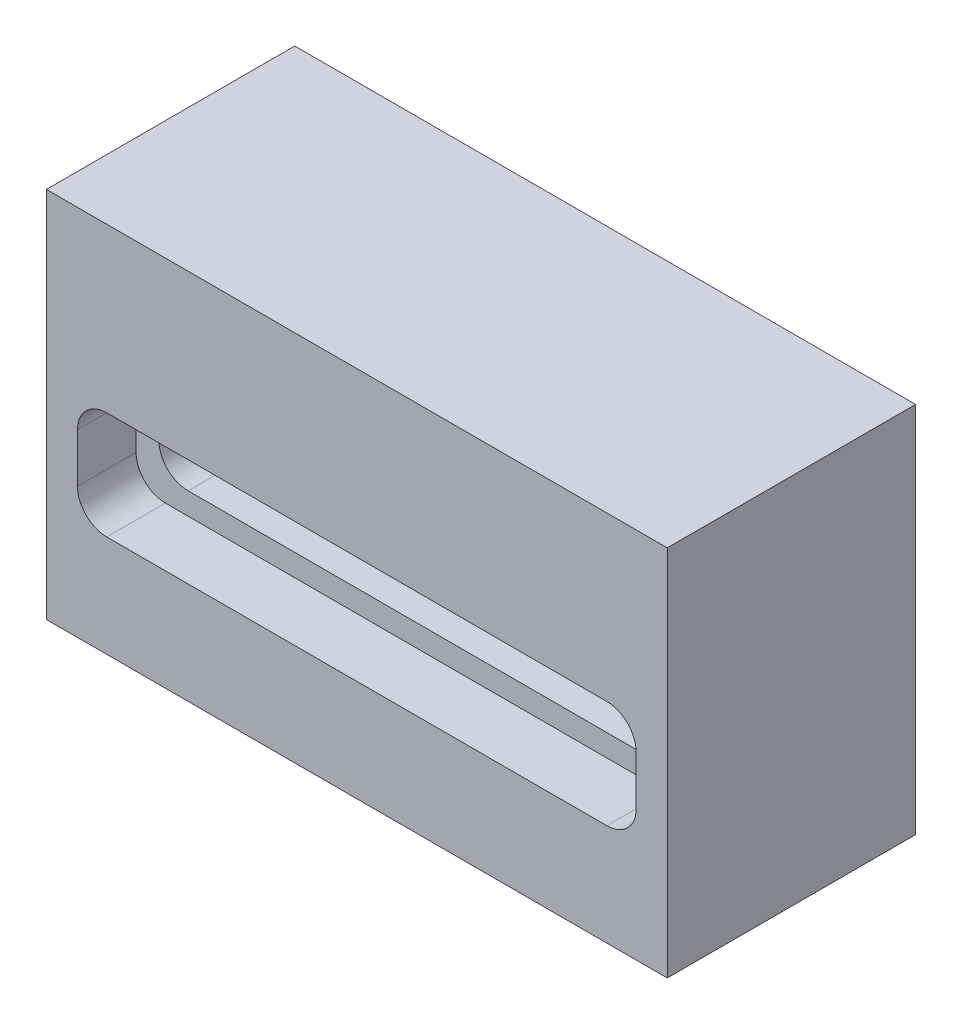
from build123d import *

# Parameters (mm, degrees)
SKETCH1_W           = 127
SKETCH1_H           = 50.8
BOSS_EXTRUDE1_DEPTH = 76.2
CUT_EXTRUDE2_DEPTH  = 12
CUT_EXTRUDE3_DEPTH  = 157.576115675


with BuildPart() as part:
    # Sketch1 → Boss-Extrude1 (new body)
    with BuildSketch(Plane(origin=(0, 0, 0), x_dir=(1, 0, 0), z_dir=(0, 1, 0))):
        with Locations((63.5, 25.4)):
            Rectangle(SKETCH1_W, SKETCH1_H)
    extrude(amount=BOSS_EXTRUDE1_DEPTH)

    # Sketch3 → Cut-Extrude2 (cut)
    with BuildSketch(Plane.XY):
        with BuildLine():
            Line((12.35, 42.8), (114.65, 42.8))
            ThreePointArc((114.65, 42.8), (118.892640687, 41.042640687), (120.65, 36.8))
            Line((120.65, 36.8), (120.65, 26.8))
            ThreePointArc((120.65, 26.8), (118.892640687, 22.557359313), (114.65, 20.8))
            Line((114.65, 20.8), (12.35, 20.8))
            ThreePointArc((12.35, 20.8), (8.107359313, 22.557359313), (6.35, 26.8))
            Line((6.35, 26.8), (6.35, 36.8))
            ThreePointArc((6.35, 36.8), (8.107359313, 41.042640687), (12.35, 42.8))
        make_face()
    extrude(amount=-CUT_EXTRUDE2_DEPTH, mode=Mode.SUBTRACT)

    # Sketch2 → Cut-Extrude3 (cut, through all)
    with BuildSketch(Plane.XY):
        with BuildLine():
            Line((17, 38.3), (110, 38.3))
            ThreePointArc((110, 38.3), (114.242640687, 36.542640687), (116, 32.3))
            Line((116, 32.3), (116, 31.3))
            ThreePointArc((116, 31.3), (114.242640687, 27.057359313), (110, 25.3))
            Line((110, 25.3), (17, 25.3))
            ThreePointArc((17, 25.3), (12.757359313, 27.057359313), (11, 31.3))
            Line((11, 31.3), (11, 32.3))
            ThreePointArc((11, 32.3), (12.757359313, 36.542640687), (17, 38.3))
        make_face()
    extrude(amount=-CUT_EXTRUDE3_DEPTH, mode=Mode.SUBTRACT)


solid = part.part
